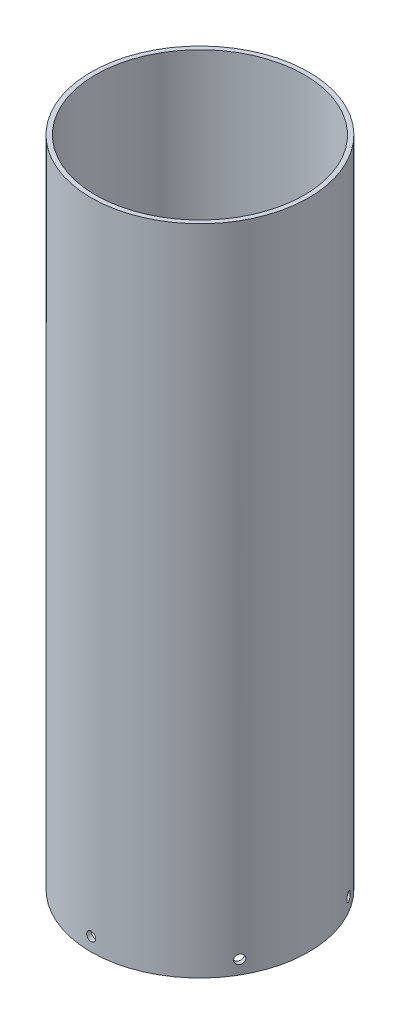
from build123d import *

# Parameters (mm, degrees)
SKETCH2_R           = 76.2
SKETCH2_R_2         = 73.025
BOSS_EXTRUDE1_DEPTH = 457.2
SKETCH3_R           = 3.175
CUT_EXTRUDE1_DEPTH  = 470.728347026
CIRPATTERN1_COUNT   = 6


with BuildPart() as part:
    # Sketch2 → Boss-Extrude1 (new body)
    with BuildSketch(Plane(origin=(0, 0, 0), x_dir=(1, 0, 0), z_dir=(0, 1, 0))):
        Circle(SKETCH2_R)
        Circle(SKETCH2_R_2, mode=Mode.SUBTRACT)
    extrude(amount=BOSS_EXTRUDE1_DEPTH)

    # Sketch3 → Cut-Extrude1 (cut, through all)
    with BuildSketch(Plane.XY):
        with Locations((0, 9.525)):
            Circle(SKETCH3_R)
    cut_extrude1 = extrude(amount=-CUT_EXTRUDE1_DEPTH, mode=Mode.SUBTRACT)

    # CirPattern1: Cut-Extrude1 ×6 about axis
    cirpattern1_axis = Axis((0, 0, 0), (0, 1, 0))
    for i in range(1, CIRPATTERN1_COUNT):
        add(cut_extrude1.rotate(cirpattern1_axis, i * 360 / CIRPATTERN1_COUNT), mode=Mode.SUBTRACT)


solid = part.part
